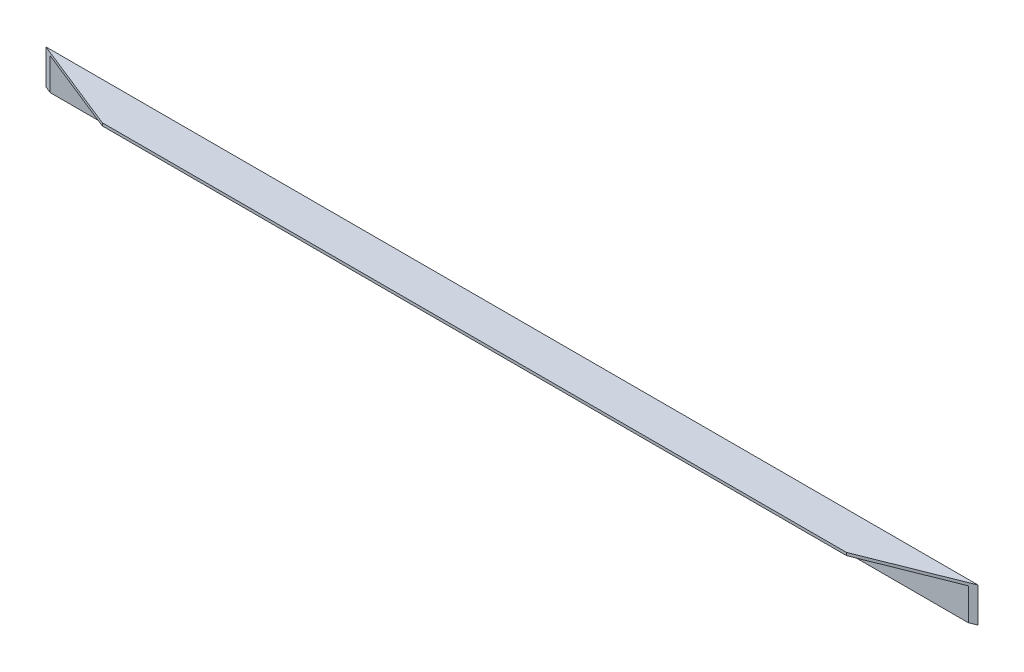
from build123d import *

# Parameters (mm, degrees)
SKETCH_1_W          = 2680
SKETCH_1_H          = 100
EXTRUDE_465_DEPTH   = 8
SKETCH_2_W          = 2680
SKETCH_2_H          = 8
EXTRUDE_1_DEPTH     = 100
CUT_EXTRUDE_1_DEPTH = 100


# Read off the part's stored shape, not the designer's step: 切除-拉伸1
with BuildPart() as part:
    # 草图1 → Extrude 465 (new body)
    with BuildSketch(Plane.XY):
        with Locations((0, 50)):
            Rectangle(SKETCH_1_W, SKETCH_1_H)
    extrude(amount=EXTRUDE_465_DEPTH)

    # 草图2 → 凸台-拉伸1 (add)
    with BuildSketch(Plane.XY.offset(8)):
        with Locations((0, 96)):
            Rectangle(SKETCH_2_W, SKETCH_2_H)
    extrude(amount=EXTRUDE_1_DEPTH)

    # 切除-拉伸1 outline → 切除-拉伸1 (cut)
    with BuildSketch(Plane(origin=(0, 0, 0), x_dir=(1, 0, 0), z_dir=(0, 1, 0))):
        Polygon((1340, -108), (1340, 0), (1070, -108), align=None)
        Polygon((-1340, -108), (-1070, -108), (-1340, 0), align=None)
    extrude(amount=CUT_EXTRUDE_1_DEPTH, mode=Mode.SUBTRACT)


solid = part.part
